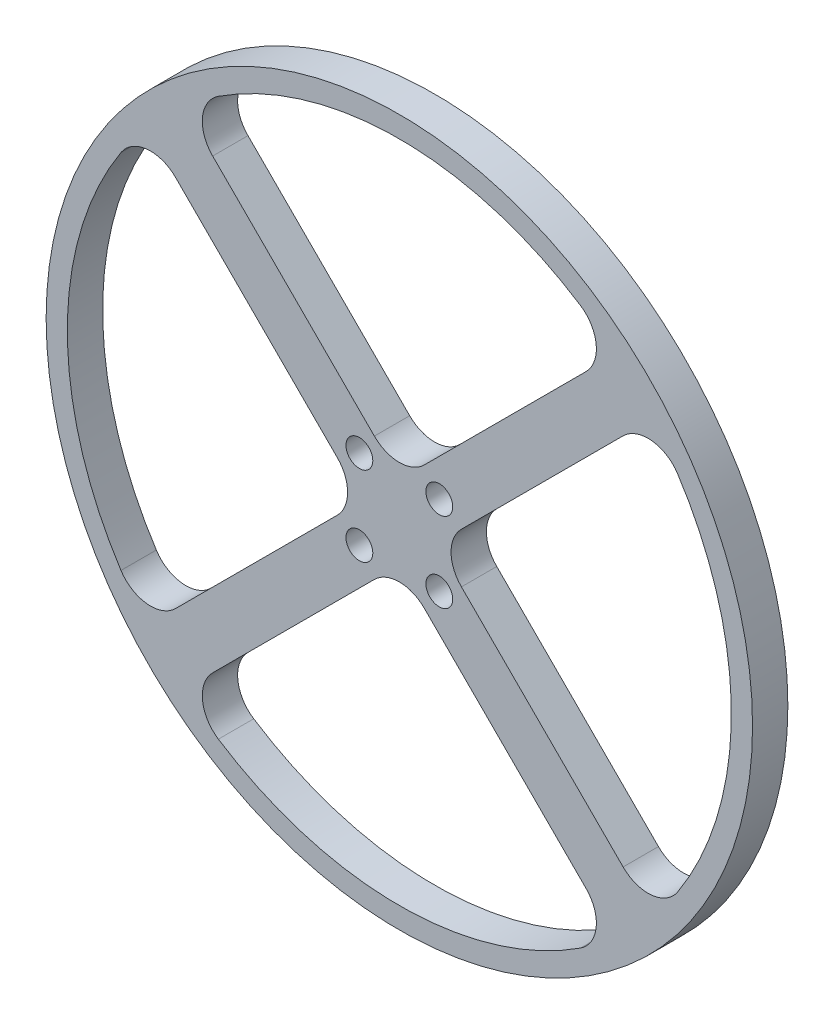
from build123d import *

# Parameters (mm, degrees)
SKETCH1_R           = 50
BOSS_EXTRUDE1_DEPTH = 5
FILLET1_R           = 5
SKETCH2_R           = 1.9
CUT_EXTRUDE1_DEPTH  = 5


with BuildPart() as part:
    # Sketch1 → Boss-Extrude1 (new body)
    with BuildSketch(Plane.XY):
        Circle(SKETCH1_R)
        with BuildLine():
            Line((30.504506916, 35.755769574), (0, 5.251262658))
            Line((0, 5.251262658), (-30.504506916, 35.755769574))
            ThreePointArc((-30.504506916, 35.755769574), (0, 47), (30.504506916, 35.755769574))
        make_face(mode=Mode.SUBTRACT)
        with BuildLine():
            Line((5.251262658, 0), (35.755769574, 30.504506916))
            ThreePointArc((35.755769574, 30.504506916), (47, 0), (35.755769574, -30.504506916))
            Line((35.755769574, -30.504506916), (5.251262658, 0))
        make_face(mode=Mode.SUBTRACT)
        with BuildLine():
            Line((0, -5.251262658), (30.504506916, -35.755769574))
            ThreePointArc((30.504506916, -35.755769574), (0, -47), (-30.504506916, -35.755769574))
            Line((-30.504506916, -35.755769574), (0, -5.251262658))
        make_face(mode=Mode.SUBTRACT)
        with BuildLine():
            Line((-5.251262658, 0), (-35.755769574, -30.504506916))
            ThreePointArc((-35.755769574, -30.504506916), (-47, 0), (-35.755769574, 30.504506916))
            Line((-35.755769574, 30.504506916), (-5.251262658, 0))
        make_face(mode=Mode.SUBTRACT)
    extrude(amount=BOSS_EXTRUDE1_DEPTH)

    # Fillet1
    fillet1_edges = [part.edges().sort_by_distance(p)[0] for p in [
        (30.504506916, -35.755769574, 2.5),
        (35.755769574, -30.504506916, 2.5),
        (-30.504506916, -35.755769574, 2.5),
        (0, -5.251262658, 2.5),
        (5.251262658, 0, 2.5),
        (35.755769574, 30.504506916, 2.5),
        (30.504506916, 35.755769574, 2.5),
        (-30.504506916, 35.755769574, 2.5),
        (-35.755769574, 30.504506916, 2.5),
        (0, 5.251262658, 2.5),
        (-5.251262658, 0, 2.5),
        (-35.755769574, -30.504506916, 2.5),
    ]]
    fillet(fillet1_edges, radius=FILLET1_R)

    # Sketch2 → Cut-Extrude1 (cut)
    with BuildSketch(Plane.XY.offset(5)):
        with Locations((5.656854249, -5.656854249)):
            Circle(SKETCH2_R)
        with Locations((5.656854249, 5.656854249)):
            Circle(SKETCH2_R)
        with Locations((-5.656854249, 5.656854249)):
            Circle(SKETCH2_R)
        with Locations((-5.656854249, -5.656854249)):
            Circle(SKETCH2_R)
    extrude(amount=-CUT_EXTRUDE1_DEPTH, mode=Mode.SUBTRACT)


solid = part.part
